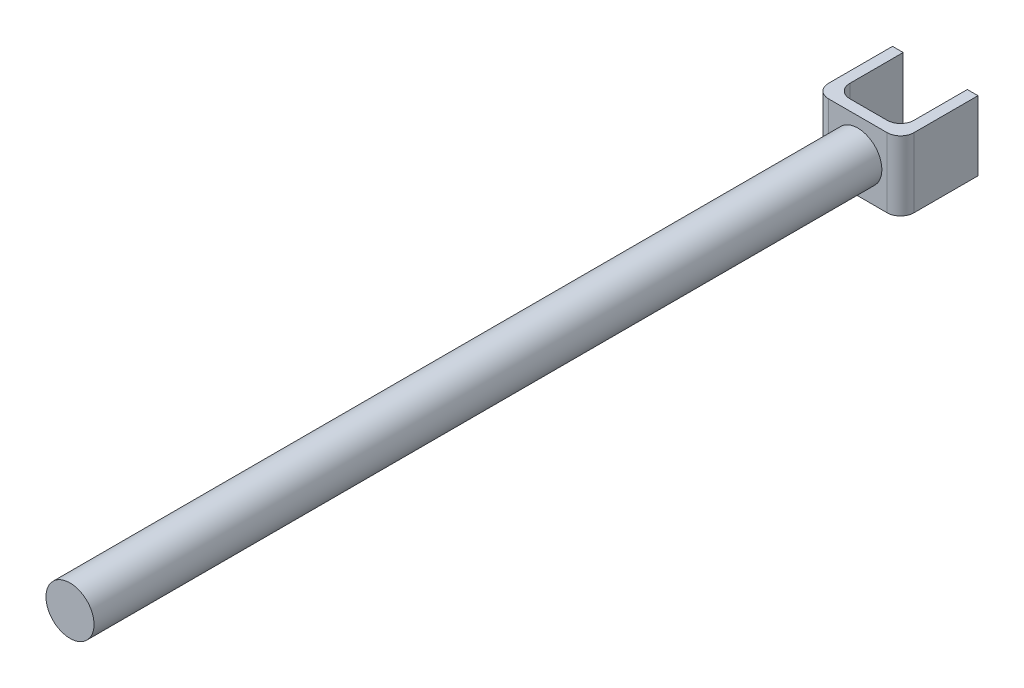
from build123d import *

# Parameters (mm, degrees)
BOSS_EXTRUDE1_DEPTH      = 13
BOSS_EXTRUDE1_DEPTH_BACK = 13
SKETCH2_R                = 9
BOSS_EXTRUDE2_DEPTH      = 295


with BuildPart() as part:
    # Sketch1 → Boss-Extrude1 (new, two sides: drawn at the far end of the back side and taken through both)
    with BuildSketch(Plane(origin=(0, 0, 0), x_dir=(1, 0, 0), z_dir=(0, 1, 0)).offset(-BOSS_EXTRUDE1_DEPTH_BACK)):
        with BuildLine():
            Line((7, -20.776256957), (-7, -20.776256957))
            ThreePointArc((-7, -20.776256957), (-10.535533906, -19.311790863), (-12, -15.776256957))
            Line((-12, -15.776256957), (-12, 4.223743043))
            Line((-12, 4.223743043), (-16, 4.223743043))
            Line((-16, 4.223743043), (-16, -19.776256957))
            ThreePointArc((-16, -19.776256957), (-14.535533906, -23.311790863), (-11, -24.776256957))
            Line((-11, -24.776256957), (11, -24.776256957))
            ThreePointArc((11, -24.776256957), (14.535533906, -23.311790863), (16, -19.776256957))
            Line((16, -19.776256957), (16, 4.223743043))
            Line((16, 4.223743043), (12, 4.223743043))
            Line((12, 4.223743043), (12, -15.776256957))
            ThreePointArc((12, -15.776256957), (10.535533906, -19.311790863), (7, -20.776256957))
        make_face()
    extrude(amount=BOSS_EXTRUDE1_DEPTH + BOSS_EXTRUDE1_DEPTH_BACK)

    # Sketch2 → Boss-Extrude2 (add)
    with BuildSketch(Plane.XY.offset(24.776256957)):
        Circle(SKETCH2_R)
    extrude(amount=BOSS_EXTRUDE2_DEPTH)


solid = part.part
